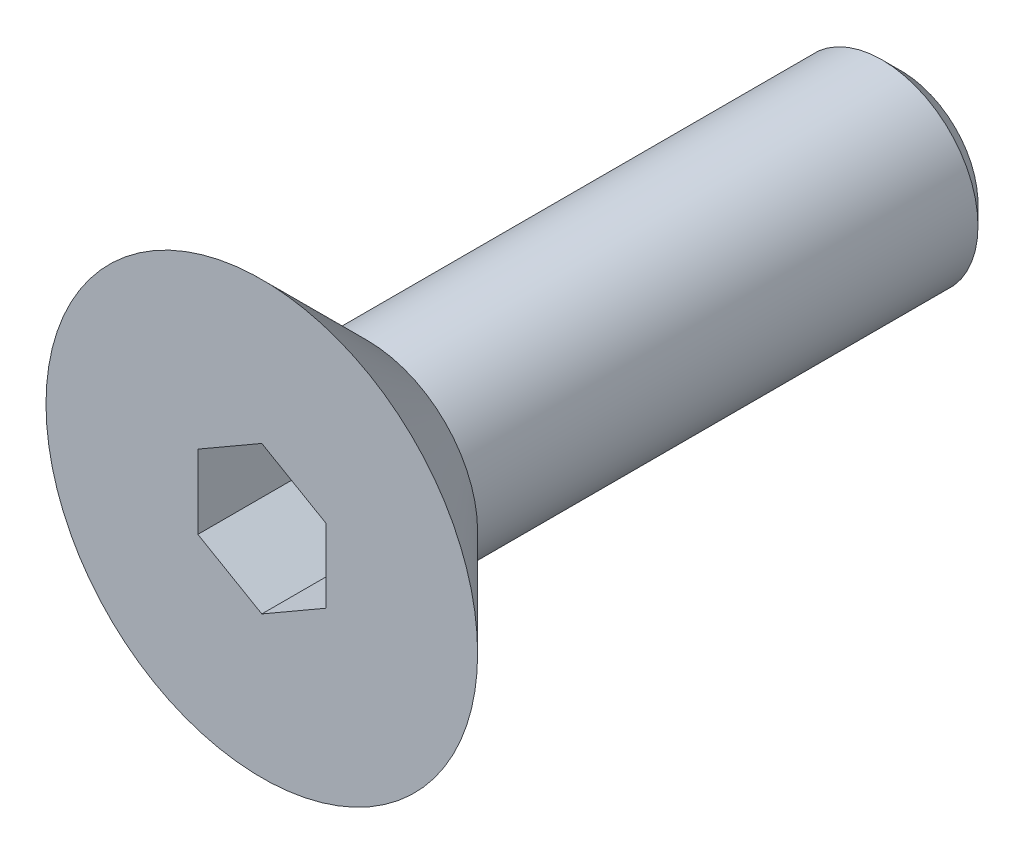
from build123d import *

# Parameters (mm, degrees)
SKETCH1_R           = 3.375
BOSS_EXTRUDE1_DEPTH = 1.65
SKETCH2_R           = 1.5
BOSS_EXTRUDE2_DEPTH = 8.35
CHAMFER1_SIZE       = 0.3
CUT_EXTRUDE1_DEPTH  = 2
CHAMFER2_SIZE       = 1.65


with BuildPart() as part:
    # Sketch1 → Boss-Extrude1 (new body)
    with BuildSketch(Plane.XY):
        Circle(SKETCH1_R)
    extrude(amount=BOSS_EXTRUDE1_DEPTH)

    # Sketch2 → Boss-Extrude2 (add)
    with BuildSketch(Plane(origin=(0, 0, 0), x_dir=(-1, 0, 0), z_dir=(0, 0, -1))):
        with Locations(Location((0, 0, 0), (0, 0, 180))):
            Circle(SKETCH2_R)
    extrude(amount=BOSS_EXTRUDE2_DEPTH)

    # Chamfer1
    chamfer1_edges = [part.edges().sort_by_distance(p)[0] for p in [
        (-1.5, 0, -8.35),
    ]]
    chamfer(chamfer1_edges, length=CHAMFER1_SIZE)

    # Sketch3 → Cut-Extrude1 (cut)
    with BuildSketch(Plane.XY.offset(1.65)):
        Polygon((0, 1.154700538), (-1, 0.577350269), (-1, -0.577350269), (0, -1.154700538), (1, -0.577350269), (1, 0.577350269), align=None)
    extrude(amount=-CUT_EXTRUDE1_DEPTH, mode=Mode.SUBTRACT)

    # Chamfer2
    chamfer2_edges = [part.edges().sort_by_distance(p)[0] for p in [
        (-3.375, 0, 0),
    ]]
    chamfer(chamfer2_edges, length=CHAMFER2_SIZE - 0.0001)  # a hair under: the kernel refuses the full size


solid = part.part
